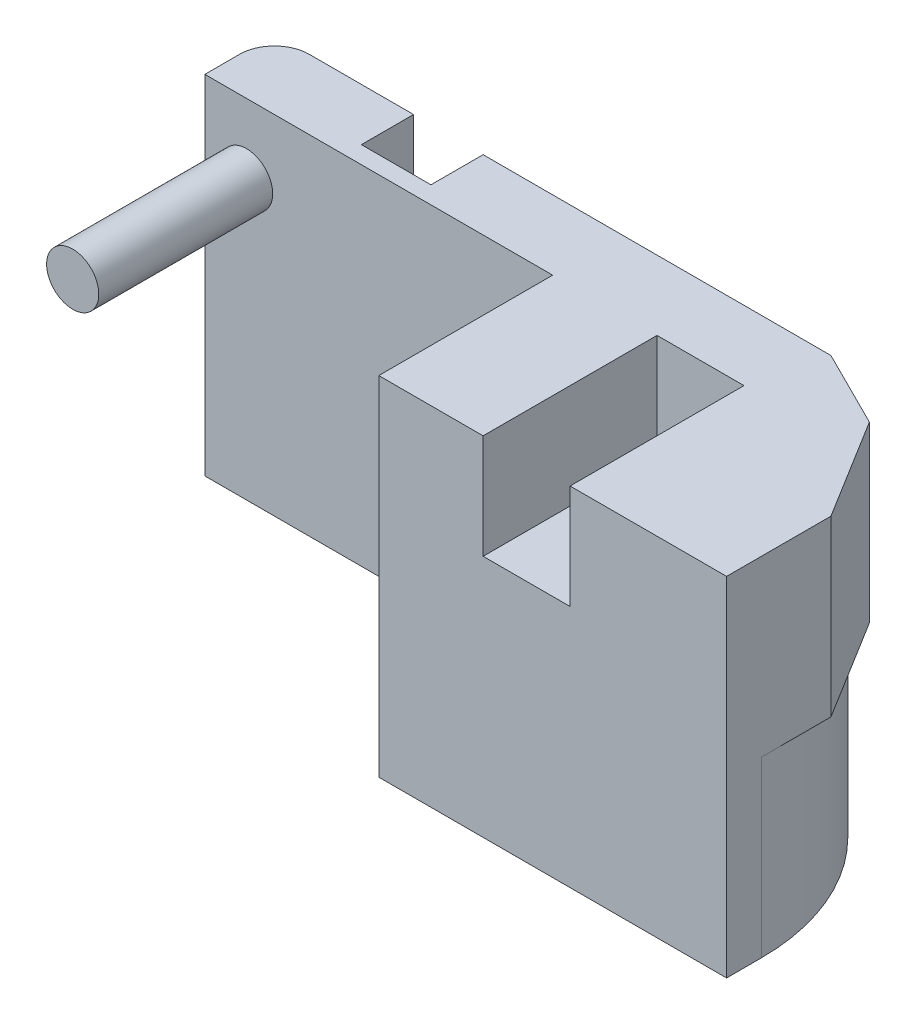
from build123d import *

# Parameters (mm, degrees)
SKICA1_W                 = 200
SKICA1_H                 = 100
P_IDAT_VYSUNUT_M1_DEPTH  = 20
P_IDAT_VYSUNUT_M2_DEPTH  = 50
SKICA7_R                 = 7.5
P_IDAT_VYSUNUT_M3_DEPTH  = 50
ODEBRAT_VYSUNUT_M3_DEPTH = 10
ZAOBLIT1_START           = 50
ZAOBLIT1_DEPTH           = 51
SKICA9_W                 = 40
SKICA9_H                 = 25
ODEBRAT_VYSUNUT_M4_DEPTH = 5
CHAMFER2_SIZE            = 5
FILLET2_DEPTH            = 50
CHAMFER3_SIZE            = 40
CHAMFER3_SIZE2           = 20
CHAMFER4_SIZE            = 20
SKETCH3_R                = 15
CUT_EXTRUDE2_DEPTH       = 60


with BuildPart() as part:
    # Skica1 → Přidat vysunutím1 (new body)
    with BuildSketch(Plane.XY):
        with Locations((100, 50)):
            Rectangle(SKICA1_W, SKICA1_H)
    extrude(amount=P_IDAT_VYSUNUT_M1_DEPTH)

    # Skica2 → Přidat vysunutím2 (add)
    with BuildSketch(Plane.XY.offset(20)):
        Polygon((100, 0), (200, 0), (200, 100), (155, 100), (155, 70), (130, 70), (130, 100), (100, 100), align=None)
    extrude(amount=P_IDAT_VYSUNUT_M2_DEPTH)

    # Skica7 → Přidat vysunutím3 (add)
    with BuildSketch(Plane.XY.offset(20)):
        with Locations(Location((12, 80, 0), (0, 0, 180))):
            Circle(SKICA7_R)
    extrude(amount=P_IDAT_VYSUNUT_M3_DEPTH)

    # Skica8 → Odebrat vysunutím3 (cut, symmetric)
    with BuildSketch(Plane.ZY.offset(-50)):
        Polygon((0, 100), (0, 70), (15, 100), align=None)
    extrude(amount=ODEBRAT_VYSUNUT_M3_DEPTH, both=True, mode=Mode.SUBTRACT)

    # Zaoblit1: read off the stored shape, not the designer's step
    # Zaoblit1 outline → Zaoblit1 (cut)
    with BuildSketch(Plane(origin=(0, 0, 0), x_dir=(1, 0, 0), z_dir=(0, 1, 0)).offset(ZAOBLIT1_START)):
        with BuildLine():
            ThreePointArc((0, -10), (2.928932188, -2.928932188), (10, 0))
            Line((10, 0), (0, 0))
            Line((0, 0), (0, -10))
        make_face()
    extrude(amount=ZAOBLIT1_DEPTH, mode=Mode.SUBTRACT)

    # Skica9 → Odebrat vysunutím4 (cut)
    with BuildSketch(Plane(origin=(0, 0, 0), x_dir=(-1, 0, 0), z_dir=(0, 0, -1))):
        with Locations((-90, 77.5)):
            Rectangle(SKICA9_W, SKICA9_H)
    extrude(amount=-ODEBRAT_VYSUNUT_M4_DEPTH, mode=Mode.SUBTRACT)

    # Chamfer2
    chamfer2_edges = [part.edges().sort_by_distance(p)[0] for p in [
        (0, 25, 0),
    ]]
    chamfer(chamfer2_edges, length=CHAMFER2_SIZE)

    # Fillet2: read off the stored shape, not the designer's step
    # Fillet2 outline → Fillet2 (cut)
    with BuildSketch(Plane(origin=(0, 0, 0), x_dir=(1, 0, 0), z_dir=(0, 1, 0))):
        with BuildLine():
            Line((200, 0), (140, 0))
            ThreePointArc((140, 0), (182.426406871, -17.573593129), (200, -60))
            Line((200, -60), (200, 0))
        make_face()
    extrude(amount=FILLET2_DEPTH, mode=Mode.SUBTRACT)

    # Chamfer3
    chamfer3_edges = [part.edges().sort_by_distance(p)[0] for p in [
        (200, 75, 0),
    ]]
    chamfer3_side = [part.faces().sort_by_distance(p)[0] for p in [
        (93.302047782, 51.38225256, 0),
    ]]
    chamfer(chamfer3_edges, length=CHAMFER3_SIZE, length2=CHAMFER3_SIZE2, reference=chamfer3_side[0])

    # Chamfer4
    chamfer4_edges = [part.edges().sort_by_distance(p)[0] for p in [
        (200, 75, 20),
    ]]
    chamfer(chamfer4_edges, length=CHAMFER4_SIZE)

    # Sketch2 → Cut-Revolve4 (revolve, cut)
    with BuildSketch(Plane(origin=(0, 0, 0), x_dir=(-1, 0, 0), z_dir=(0, 0, -1))):
        with BuildLine():
            Line((-50, 35), (-50, 5))
            ThreePointArc((-50, 5), (-35, 20), (-50, 35))
        make_face()
    revolve(axis=Axis((50, 35, 0), (0, -1, 0)), mode=Mode.SUBTRACT)

    # Sketch3 → Cut-Extrude2 (cut)
    with BuildSketch(Plane(origin=(0, 0, 0), x_dir=(-1, 0, 0), z_dir=(0, 0, -1))):
        with Locations((-120, 20)):
            Circle(SKETCH3_R)
    extrude(amount=-CUT_EXTRUDE2_DEPTH, mode=Mode.SUBTRACT)


solid = part.part
